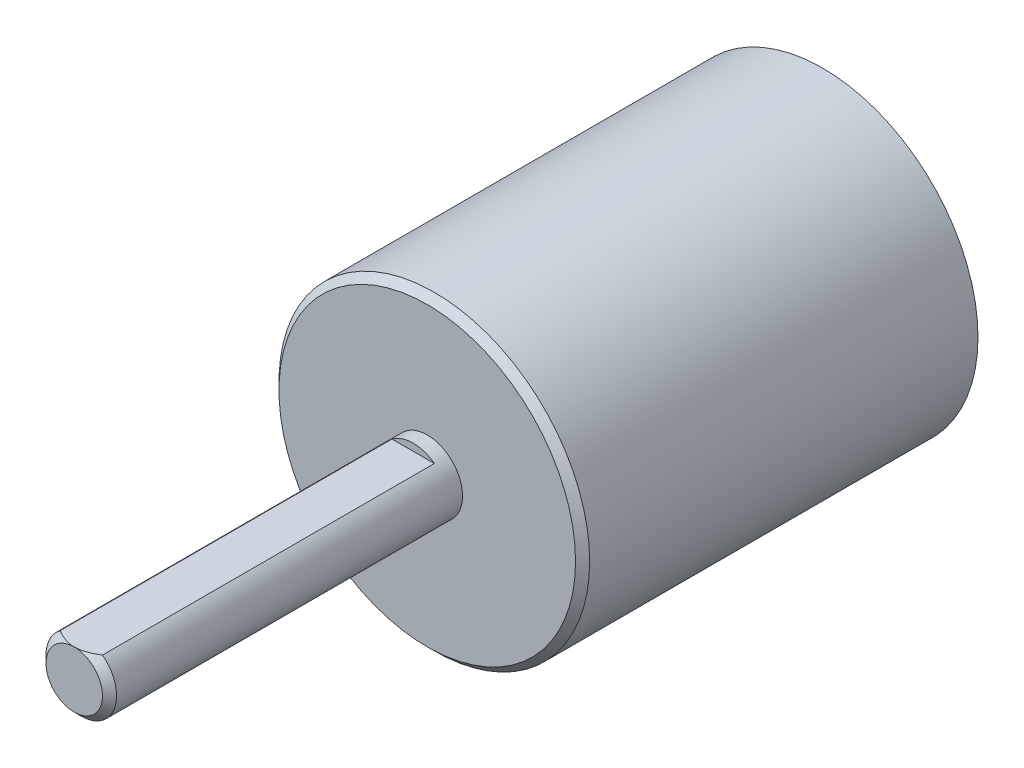
from build123d import *

# Parameters (mm, degrees)
SKETCH1_R           = 11
SKETCH1_R_2         = 2.5
BOSS_EXTRUDE1_DEPTH = 28
BOSS_EXTRUDE2_START = 28
BOSS_EXTRUDE2_DEPTH = 25
CUT_EXTRUDE1_START  = 29
CUT_EXTRUDE1_DEPTH  = 24
CHAMFER1_SIZE       = 0.5


with BuildPart() as part:
    # Sketch1 → Boss-Extrude1 (new body)
    # profile 1 of 5: a face of its own
    with BuildSketch(Plane.XY):
        Circle(SKETCH1_R)
        Circle(SKETCH1_R_2, mode=Mode.SUBTRACT)
    # profile 2 of 5: a face of its own
    with BuildSketch(Plane.XY):
        with BuildLine():
            ThreePointArc((1.5, 2), (0, 2.5), (-1.5, 2))
            Line((-1.5, 2), (1.5, 2))
        make_face()
    # profile 3 of 5: a face of its own
    with BuildSketch(Plane.XY):
        with BuildLine():
            Line((1.5, 2), (-1.5, 2))
            ThreePointArc((-1.5, 2), (-1.118033989, -2.236067977), (2.5, 0))
            ThreePointArc((2.5, 0), (2.236067977, 1.118033989), (1.5, 2))
        make_face()
    # profile 4 of 5: a face of its own
    with BuildSketch(Plane.XY):
        with BuildLine():
            ThreePointArc((1.5, 2), (0, 2.5), (-1.5, 2))
            Line((-1.5, 2), (1.5, 2))
        make_face()
    # profile 5 of 5: a face of its own
    with BuildSketch(Plane.XY):
        with BuildLine():
            Line((1.5, 2), (-1.5, 2))
            ThreePointArc((-1.5, 2), (-1.118033989, -2.236067977), (2.5, 0))
            ThreePointArc((2.5, 0), (2.236067977, 1.118033989), (1.5, 2))
        make_face()
    extrude(amount=BOSS_EXTRUDE1_DEPTH)

    # Sketch1<3> → Boss-Extrude2 (add)
    with BuildSketch(Plane.XY.offset(BOSS_EXTRUDE2_START)):
        with BuildLine():
            ThreePointArc((1.5, 2), (0, 2.5), (-1.5, 2))
            Line((-1.5, 2), (1.5, 2))
        make_face()
        with BuildLine():
            Line((1.5, 2), (-1.5, 2))
            ThreePointArc((-1.5, 2), (-1.118033989, -2.236067977), (2.5, 0))
            ThreePointArc((2.5, 0), (2.236067977, 1.118033989), (1.5, 2))
        make_face()
    extrude(amount=BOSS_EXTRUDE2_DEPTH)

    # Sketch1<4> → Cut-Extrude1 (cut)
    with BuildSketch(Plane.XY.offset(CUT_EXTRUDE1_START)):
        with BuildLine():
            ThreePointArc((1.5, 2), (0, 2.5), (-1.5, 2))
            Line((-1.5, 2), (1.5, 2))
        make_face()
    extrude(amount=CUT_EXTRUDE1_DEPTH, mode=Mode.SUBTRACT)

    # Chamfer1
    chamfer1_edges = [part.edges().sort_by_distance(p)[0] for p in [
        (-11, 0, 28),
        (-1.118033989, -2.236067977, 53),
    ]]
    chamfer(chamfer1_edges, length=CHAMFER1_SIZE - 0.0001)  # a hair under: the kernel refuses the full size


solid = part.part
